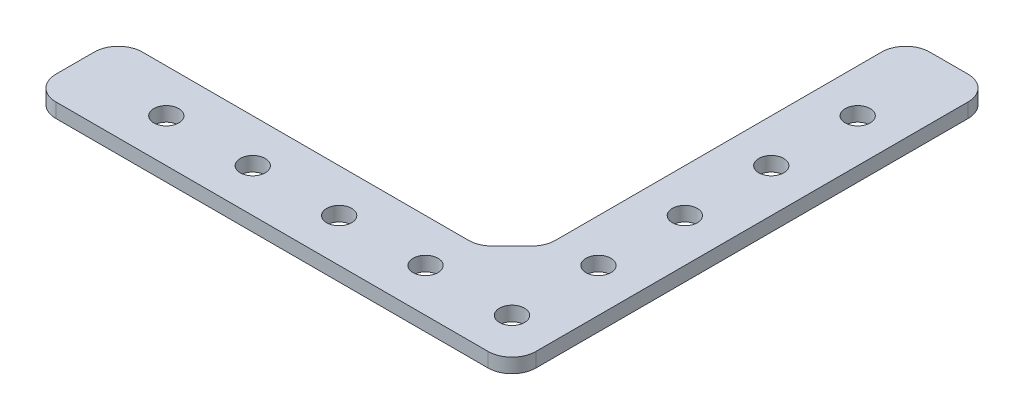
from build123d import *

# Parameters (mm, degrees)
SKETCH1_R          = 2.6
BASE_FLANGE1_DEPTH = 3
FILLET1_R          = 5
FILLET2_R          = 5


# Sheet-metal steps are written as plain solids
with BuildPart() as part:
    # Sketch1 → Base-Flange1 (new body)
    with BuildSketch(Plane(origin=(0, 0, 0), x_dir=(1, 0, 0), z_dir=(0, 1, 0))):
        Polygon((32, 50), (50, 50), (50, -50), (-50, -50), (-50, -32), (25, -32), (32, -25), align=None)
        with Locations(Location((41, -41, 0), (0, 0, 270))):
            Circle(SKETCH1_R, mode=Mode.SUBTRACT)
        with Locations(Location((23, -41, 0), (0, 0, 270))):
            Circle(SKETCH1_R, mode=Mode.SUBTRACT)
        with Locations(Location((5, -41, 0), (0, 0, 270))):
            Circle(SKETCH1_R, mode=Mode.SUBTRACT)
        with Locations(Location((-13, -41, 0), (0, 0, 270))):
            Circle(SKETCH1_R, mode=Mode.SUBTRACT)
        with Locations(Location((-31, -41, 0), (0, 0, 270))):
            Circle(SKETCH1_R, mode=Mode.SUBTRACT)
        with Locations(Location((41, -23, 0), (0, 0, 270))):
            Circle(SKETCH1_R, mode=Mode.SUBTRACT)
        with Locations(Location((41, -5, 0), (0, 0, 270))):
            Circle(SKETCH1_R, mode=Mode.SUBTRACT)
        with Locations(Location((41, 13, 0), (0, 0, 270))):
            Circle(SKETCH1_R, mode=Mode.SUBTRACT)
        with Locations(Location((41, 31, 0), (0, 0, 270))):
            Circle(SKETCH1_R, mode=Mode.SUBTRACT)
    extrude(amount=-BASE_FLANGE1_DEPTH)

    # Fillet1
    fillet1_edges = [part.edges().sort_by_distance(p)[0] for p in [
        (25, -1.5, 32),
        (32, -1.5, 25),
    ]]
    fillet(fillet1_edges, radius=FILLET1_R)

    # Fillet2
    fillet2_edges = [part.edges().sort_by_distance(p)[0] for p in [
        (50, -1.5, 50),
        (-50, -1.5, 50),
        (-50, -1.5, 32),
        (32, -1.5, -50),
        (50, -1.5, -50),
    ]]
    fillet(fillet2_edges, radius=FILLET2_R)


solid = part.part
